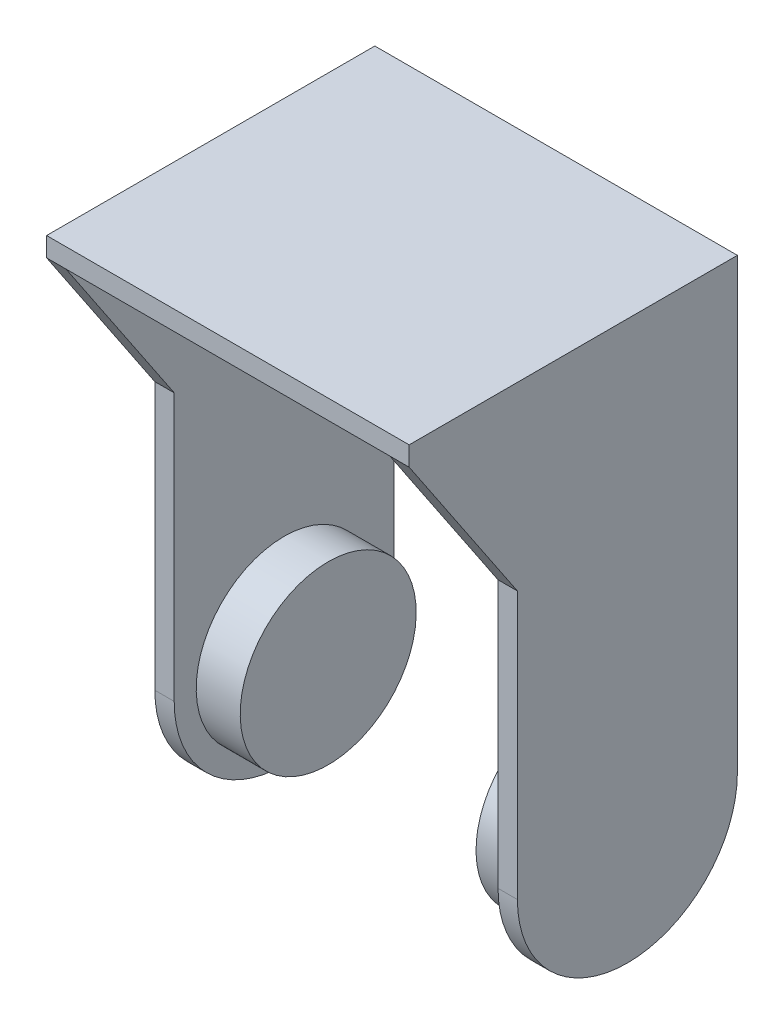
from build123d import *

# Parameters (mm, degrees)
BOSS_EXTRUDE1_DEPTH = 41.2
SKETCH4_W           = 36.8
SKETCH4_H           = 61.2
CUT_EXTRUDE1_DEPTH  = 10000
SKETCH5_R           = 10
BOSS_EXTRUDE2_DEPTH = 5
FILLET1_R           = 12.5


with BuildPart() as part:
    # Sketch2 → Boss-Extrude1 (new body)
    with BuildSketch(Plane(origin=(0, 0, 0), x_dir=(0, 0, -1), z_dir=(1, 0, 0))):
        Polygon((0, 0), (-25, 0), (-25, 42.867109497), (-37.3, 61.2), (-37.3, 63.4), (0, 63.4), align=None)
    extrude(amount=BOSS_EXTRUDE1_DEPTH)

    # Sketch4 → Cut-Extrude1 (cut)
    with BuildSketch(Plane.XY):
        with Locations((20.6, 30.6)):
            Rectangle(SKETCH4_W, SKETCH4_H)
    extrude(amount=CUT_EXTRUDE1_DEPTH, mode=Mode.SUBTRACT)

    # Sketch5 → Boss-Extrude2 (add)
    with BuildSketch(Plane(origin=(2.2, 0, 0), x_dir=(0, 0, -1), z_dir=(1, 0, 0))):
        with Locations(Location((-12.5, 12.5, 0), (0, 0, 90))):
            Circle(SKETCH5_R)
    boss_extrude2 = extrude(amount=BOSS_EXTRUDE2_DEPTH)

    # Mirror1: Boss-Extrude2 across plane
    add(boss_extrude2.mirror(Plane(origin=(20.6, 0, 0), x_dir=(0, 0, 1), z_dir=(1, 0, 0))))

    # Fillet1
    fillet1_edges = [part.edges().sort_by_distance(p)[0] for p in [
        (1.1, 0, 25),
        (1.1, 0, 0),
        (40.1, 0, 0),
        (40.1, 0, 25),
    ]]
    fillet(fillet1_edges, radius=FILLET1_R - 0.0001)  # a hair under: the kernel refuses the full size


solid = part.part
